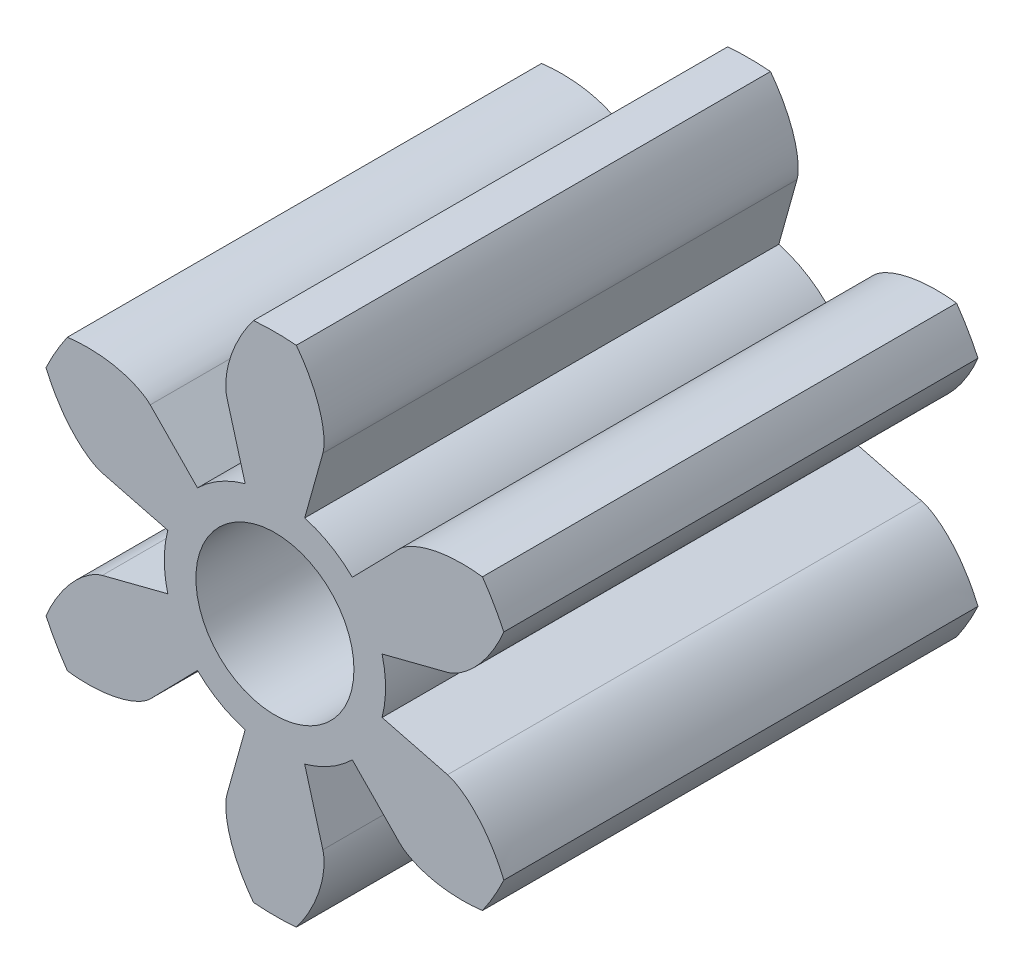
from build123d import *

# Parameters (mm, degrees)
SKETCH_1_R               = 1.6
SKETCH_1_R_2             = 0.5
EXTRUDE_1_DEPTH          = 3
CUT_EXTRUDE_1_DEPTH      = 4.757658846
PATTERN_CIRCULAR_1_COUNT = 6
PATTERN_CIRCULAR_1_ANGLE = 300


with BuildPart() as part:
    # 草图1 → 凸台-拉伸1 (new body)
    with BuildSketch(Plane.XY):
        Circle(SKETCH_1_R)
        Circle(SKETCH_1_R_2, mode=Mode.SUBTRACT)
    extrude(amount=EXTRUDE_1_DEPTH)

    # 草图1<3> → 切除-拉伸1 (cut, through all)
    with BuildSketch(Plane.XY):
        with BuildLine():
            Line((1.092216364, 0.280384403), (0.678015553, 0.174054329))
            ThreePointArc((0.678015553, 0.174054329), (0.694482141, 0.08771862), (0.7, 0))
            ThreePointArc((0.7, 0), (0.694482141, -0.08771862), (0.678015553, -0.174054329))
            Line((0.678015553, -0.174054329), (1.092216364, -0.280384403))
            add(Edge.make_bspline(
                [(1.092216364, -0.280384403), (1.100542033, -0.282521697), (1.123332141, -0.290216578), (1.164208703, -0.31159281), (1.225071922, -0.354996608), (1.29438149, -0.422933465), (1.363525729, -0.513258161), (1.409056075, -0.593081077), (1.435803061, -0.650072876), (1.448390311, -0.679827556)],
                knots=[0, 0, 0, 0, 0, 0.005604068, 0.015718248, 0.029959916, 0.048733667, 0.068727063, 0.089838775, 0.089838775, 0.089838775, 0.089838775, 0.089838775], degree=4))
            ThreePointArc((1.448390311, -0.679827556), (1.561637682, -0.34826391), (1.6, 0))
            ThreePointArc((1.6, 0), (1.561637682, 0.34826391), (1.448390311, 0.679827556))
            add(Edge.make_bspline(
                [(1.092216364, 0.280384403), (1.100542033, 0.282521697), (1.123332141, 0.290216578), (1.164208703, 0.31159281), (1.225071922, 0.354996608), (1.29438149, 0.422933465), (1.363525729, 0.513258161), (1.409056075, 0.593081077), (1.435803061, 0.650072876), (1.448390311, 0.679827556)],
                knots=[0, 0, 0, 0, 0, 0.005604068, 0.015718248, 0.029959916, 0.048733667, 0.068727063, 0.089838775, 0.089838775, 0.089838775, 0.089838775, 0.089838775], degree=4))
        make_face()
    cut_extrude_1 = extrude(amount=CUT_EXTRUDE_1_DEPTH, mode=Mode.SUBTRACT)

    # 阵列(圆周)1: 切除-拉伸1 ×6 about axis
    pattern_circular_1_axis = Axis((0, 0, 3), (0, 0, 1))
    for i in range(1, PATTERN_CIRCULAR_1_COUNT):
        add(cut_extrude_1.rotate(pattern_circular_1_axis, i * PATTERN_CIRCULAR_1_ANGLE / (PATTERN_CIRCULAR_1_COUNT - 1)), mode=Mode.SUBTRACT)


solid = part.part
